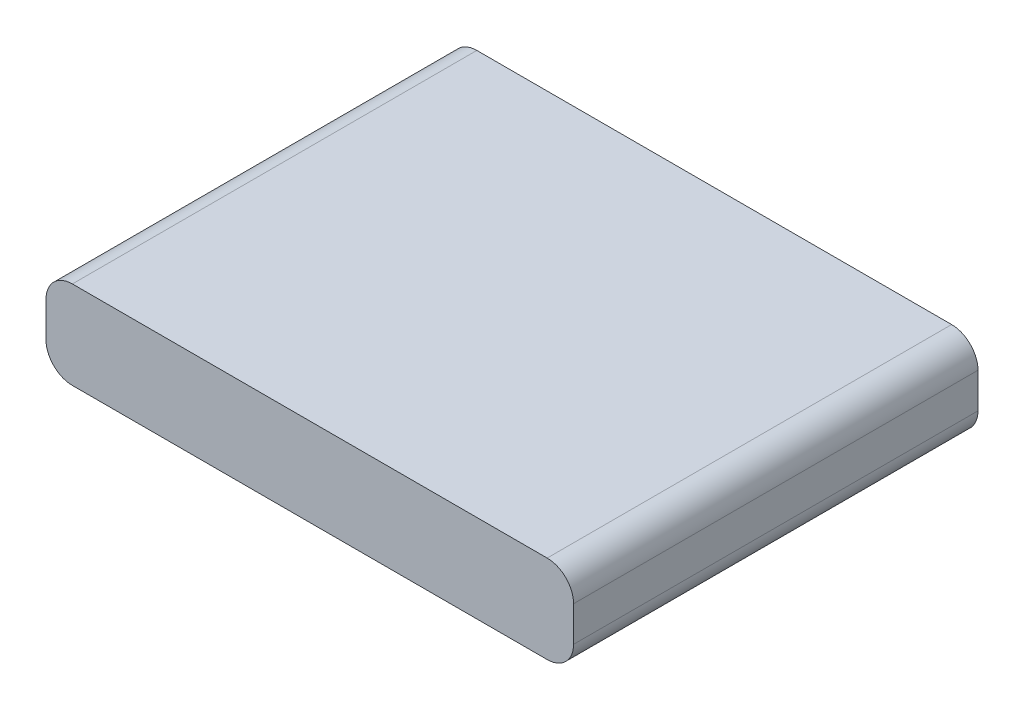
from build123d import *

# Parameters (mm, degrees)
BOSS_EXTRUDE1_DEPTH = 23
SKETCH2_R           = 2
CUT_EXTRUDE1_DEPTH  = 7.5


with BuildPart() as part:
    # Sketch1 → Boss-Extrude1 (new, symmetric)
    with BuildSketch(Plane.XY):
        with BuildLine():
            Line((-27, 0), (27, 0))
            ThreePointArc((27, 0), (29.121320344, 0.878679656), (30, 3))
            Line((30, 3), (30, 7))
            ThreePointArc((30, 7), (29.121320344, 9.121320344), (27, 10))
            Line((27, 10), (-27, 10))
            ThreePointArc((-27, 10), (-29.121320344, 9.121320344), (-30, 7))
            Line((-30, 7), (-30, 3))
            ThreePointArc((-30, 3), (-29.121320344, 0.878679656), (-27, 0))
        make_face()
    extrude(amount=BOSS_EXTRUDE1_DEPTH, both=True)

    # Sketch2 → Cut-Extrude1 (cut)
    with BuildSketch(Plane(origin=(0, 0, 0), x_dir=(1, 0, 0), z_dir=(0, 1, 0))):
        with Locations((12, -17.5)):
            Circle(SKETCH2_R)
        with Locations((-12, 17.5)):
            Circle(SKETCH2_R)
    extrude(amount=CUT_EXTRUDE1_DEPTH, mode=Mode.SUBTRACT)


solid = part.part
